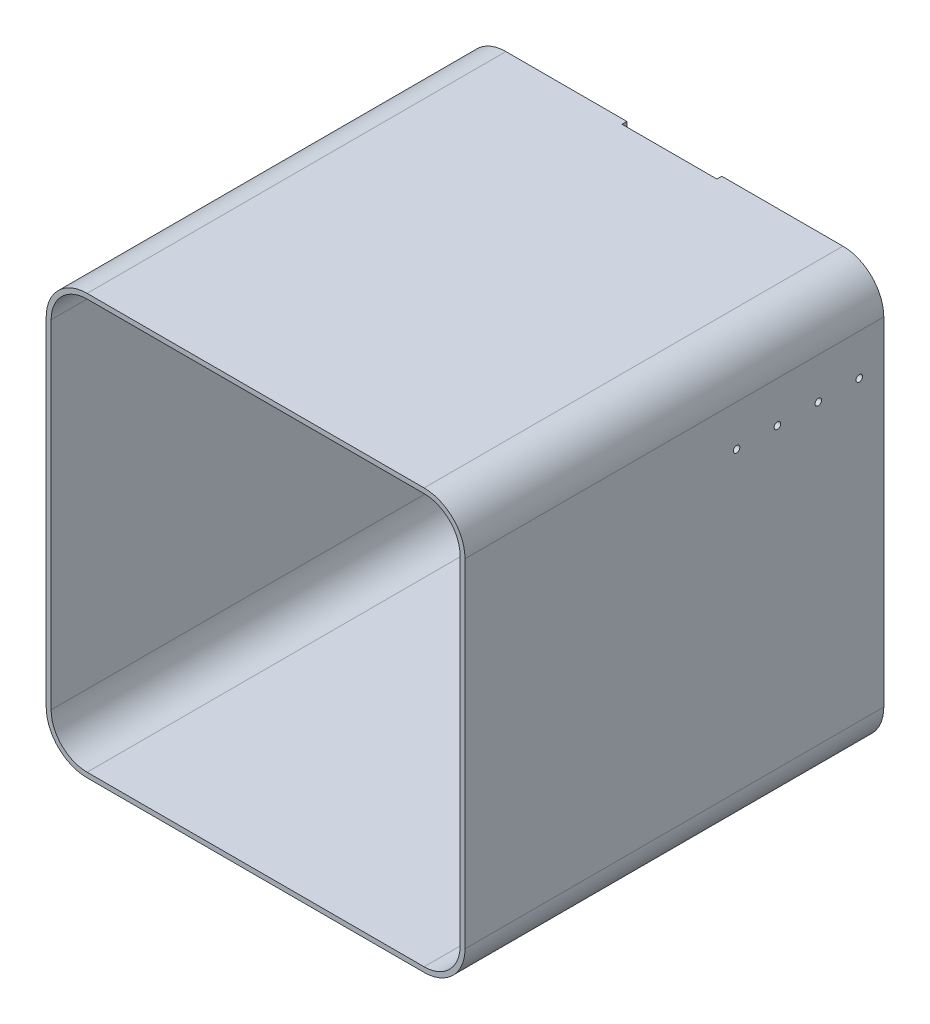
from build123d import *

# Parameters (mm, degrees)
EXTRUDE_THIN1_DEPTH = 512
SKETCH3_R           = 4
CUT_EXTRUDE1_DEPTH  = 10
LPATTERN1_COUNT     = 4
LPATTERN1_PITCH     = 50
SKETCH4_W           = 116
SKETCH4_H           = 6
CUT_EXTRUDE2_DEPTH  = 6


with BuildPart() as part:
    # Sketch1 → Extrude-Thin1 (new body)
    with BuildSketch(Plane.XY):
        with BuildLine():
            Line((44, -6), (456, -6))
            ThreePointArc((456, -6), (491.355339059, 8.644660941), (506, 44))
            Line((506, 44), (506, 457))
            ThreePointArc((506, 457), (491.355339059, 492.355339059), (456, 507))
            Line((456, 507), (44, 507))
            ThreePointArc((44, 507), (8.644660941, 492.355339059), (-6, 457))
            Line((-6, 457), (-6, 44))
            ThreePointArc((-6, 44), (8.644660941, 8.644660941), (44, -6))
        make_face()
        with BuildLine():
            Line((44, 0), (456, 0))
            ThreePointArc((456, 0), (487.112698372, 12.887301628), (500, 44))
            Line((500, 44), (500, 457))
            ThreePointArc((500, 457), (487.112698372, 488.112698372), (456, 501))
            Line((456, 501), (44, 501))
            ThreePointArc((44, 501), (12.887301628, 488.112698372), (0, 457))
            Line((0, 457), (0, 44))
            ThreePointArc((0, 44), (12.887301628, 12.887301628), (44, 0))
        make_face(mode=Mode.SUBTRACT)
    extrude(amount=-EXTRUDE_THIN1_DEPTH)

    # Sketch3 → Cut-Extrude1 (cut)
    with BuildSketch(Plane(origin=(506, 0, 0), x_dir=(0, 0, -1), z_dir=(1, 0, 0))):
        with Locations((482, 407)):
            Circle(SKETCH3_R)
    cut_extrude1 = extrude(amount=-CUT_EXTRUDE1_DEPTH, mode=Mode.SUBTRACT)

    # LPattern1: Cut-Extrude1 ×4
    with Locations(*[(0, 0, i * LPATTERN1_PITCH) for i in range(1, LPATTERN1_COUNT)]):
        add(cut_extrude1, mode=Mode.SUBTRACT)

    # Sketch4 → Cut-Extrude2 (cut)
    with BuildSketch(Plane(origin=(0, 0, -512), x_dir=(-1, 0, 0), z_dir=(0, 0, -1))):
        with Locations((-250, 504)):
            Rectangle(SKETCH4_W, SKETCH4_H)
    extrude(amount=-CUT_EXTRUDE2_DEPTH, mode=Mode.SUBTRACT)


solid = part.part
